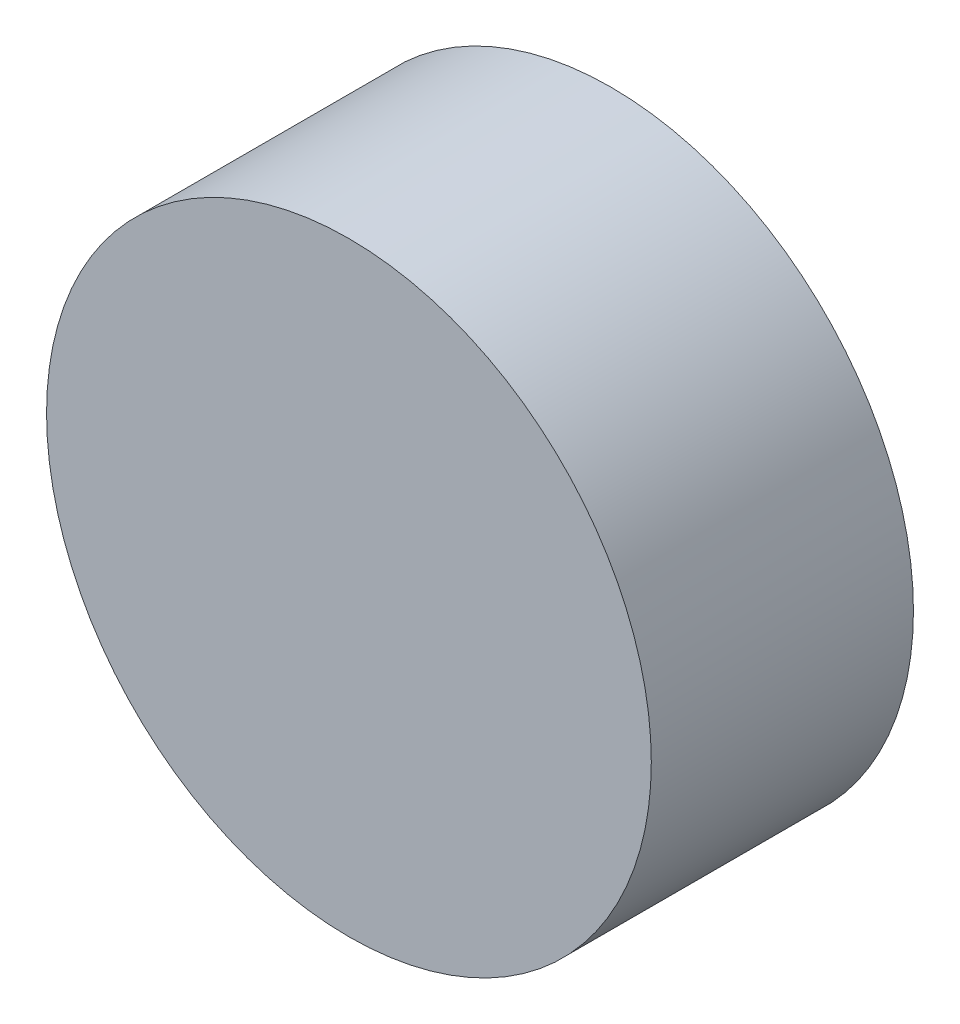
from build123d import *

# Parameters (mm, degrees)
SKETCH1_R           = 13.15
BOSS_EXTRUDE1_DEPTH = 11.4


with BuildPart() as part:
    # Sketch1 → Boss-Extrude1 (new body)
    with BuildSketch(Plane.XY):
        Circle(SKETCH1_R)
    extrude(amount=BOSS_EXTRUDE1_DEPTH)


solid = part.part
